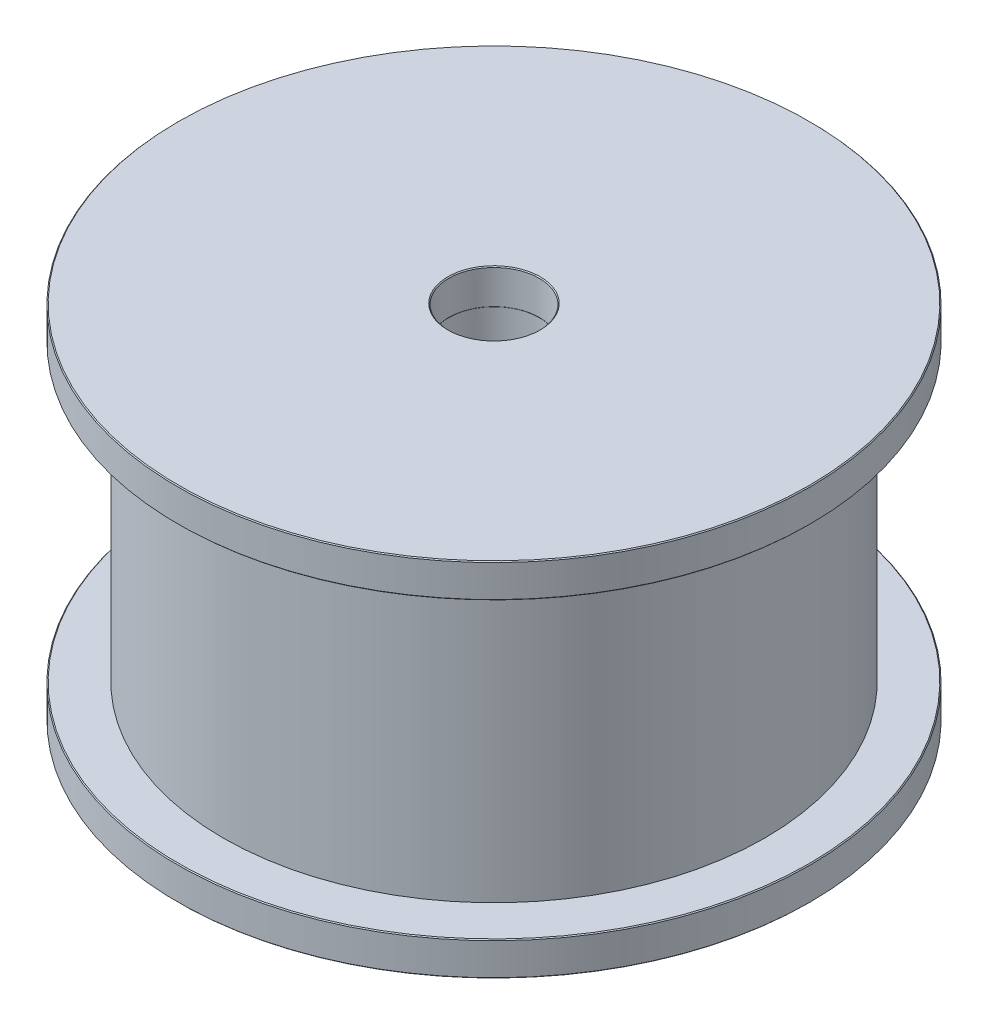
from build123d import *

# Parameters (mm, degrees)
CHAMFER1_SIZE = 0.127


with BuildPart() as part:
    # Sketch1 → Revolve1 (revolve)
    with BuildSketch(Plane.XY, mode=Mode.PRIVATE) as revolve1_sk:
        Polygon((6.3627, 0), (44.45, 0), (44.45, 4.7625), (38.1, 4.7625), (38.1, 46.0375), (44.45, 46.0375), (44.45, 50.8), (6.3627, 50.8), (6.3627, 46.0248), (6.35, 46.0248), (6.35, 4.7752), (6.3627, 4.7752), align=None)
    revolve(revolve1_sk.sketch.rotate(Axis((0, 50.8, 0), (0, -1, 0)), 180), axis=Axis((0, 50.8, 0), (0, -1, 0)))

    # Chamfer1
    # the kernel refuses this chamfer: 0.127 mm, written as the material it takes off along each edge
    with BuildSketch(Plane(origin=(0, 46.0375, 0), x_dir=(-1, 0, 0), z_dir=(0, 0, 1))) as chamfer1_piece_1:
        Polygon((44.45 - CHAMFER1_SIZE, 0), (44.45, -CHAMFER1_SIZE), (44.45, 0), align=None)
    revolve(axis=Axis((0, 46.0375, 0), (0, -1, 0)), mode=Mode.SUBTRACT)
    with BuildSketch(Plane(origin=(0, 4.7625, 0), x_dir=(-1, 0, 0), z_dir=(0, 0, 1))) as chamfer1_piece_2:
        Polygon((44.45, CHAMFER1_SIZE), (44.45 - CHAMFER1_SIZE, 0), (44.45, 0), align=None)
    revolve(axis=Axis((0, 4.7625, 0), (0, -1, 0)), mode=Mode.SUBTRACT)
    with BuildSketch(Plane(origin=(0, 0, 0), x_dir=(-1, 0, 0), z_dir=(0, 0, 1))) as chamfer1_piece_3:
        Polygon((6.3627 + CHAMFER1_SIZE, 0), (6.3627, -CHAMFER1_SIZE), (6.3627, 0), align=None)
    revolve(axis=Axis((0, 0, 0), (0, -1, 0)), mode=Mode.SUBTRACT)
    with BuildSketch(Plane(origin=(0, 0, 0), x_dir=(-1, 0, 0), z_dir=(0, 0, 1))) as chamfer1_piece_4:
        Polygon((44.45 - CHAMFER1_SIZE, 0), (44.45, -CHAMFER1_SIZE), (44.45, 0), align=None)
    revolve(axis=Axis((0, 0, 0), (0, -1, 0)), mode=Mode.SUBTRACT)
    with BuildSketch(Plane(origin=(0, 46.0248, 0), x_dir=(-1, 0, 0), z_dir=(0, 0, 1))) as chamfer1_piece_5_section:
        Polygon((6.35 + CHAMFER1_SIZE, 0), (6.35, CHAMFER1_SIZE), (6.35, 0), align=None)
    chamfer1_piece_5 = revolve(axis=Axis((0, 46.0248, 0), (0, -1, 0)), mode=Mode.PRIVATE)
    chamfer1_piece_5 = chamfer1_piece_5 & Plane(origin=(0, 45.905383225, 0), x_dir=(-1, 0, 0), z_dir=(0, -1, 0)) * Cylinder(6.3627, 26, mode=Mode.PRIVATE)
    add(chamfer1_piece_5, mode=Mode.SUBTRACT)
    with BuildSketch(Plane(origin=(0, 4.7752, 0), x_dir=(-1, 0, 0), z_dir=(0, 0, 1))) as chamfer1_piece_6_section:
        Polygon((6.35, -CHAMFER1_SIZE), (6.35 + CHAMFER1_SIZE, 0), (6.35, 0), align=None)
    chamfer1_piece_6 = revolve(axis=Axis((0, 4.7752, 0), (0, -1, 0)), mode=Mode.PRIVATE)
    chamfer1_piece_6 = chamfer1_piece_6 & Plane(origin=(0, 4.894616775, 0), x_dir=(-1, 0, 0), z_dir=(0, -1, 0)) * Cylinder(6.3627, 26, mode=Mode.PRIVATE)
    add(chamfer1_piece_6, mode=Mode.SUBTRACT)
    with BuildSketch(Plane(origin=(0, 50.8, 0), x_dir=(-1, 0, 0), z_dir=(0, 0, 1))) as chamfer1_piece_7:
        Polygon((44.45, CHAMFER1_SIZE), (44.45 - CHAMFER1_SIZE, 0), (44.45, 0), align=None)
    revolve(axis=Axis((0, 50.8, 0), (0, -1, 0)), mode=Mode.SUBTRACT)
    with BuildSketch(Plane(origin=(0, 50.8, 0), x_dir=(-1, 0, 0), z_dir=(0, 0, 1))) as chamfer1_piece_8:
        Polygon((6.3627 + CHAMFER1_SIZE, 0), (6.3627, CHAMFER1_SIZE), (6.3627, 0), align=None)
    revolve(axis=Axis((0, 50.8, 0), (0, -1, 0)), mode=Mode.SUBTRACT)


solid = part.part
